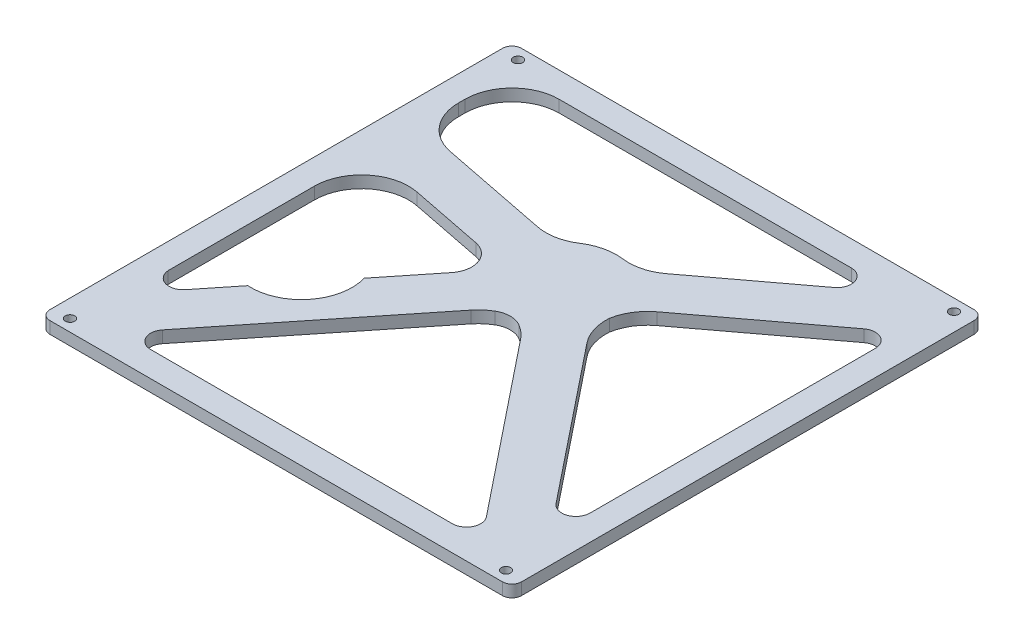
from build123d import *

# Parameters (mm, degrees)
SKETCH1_W           = 100
SKETCH1_H           = 100
BOSS_EXTRUDE1_DEPTH = 2.54
FILLET1_R           = 2
CUT_EXTRUDE1_DEPTH  = 10
SKETCH2_R           = 1
CUT_EXTRUDE2_DEPTH  = 10
FILLET2_R           = 10
FILLET3_R           = 5


with BuildPart() as part:
    # Sketch1 → Boss-Extrude1 (new body)
    with BuildSketch(Plane.XZ):
        Rectangle(SKETCH1_W, SKETCH1_H)
    extrude(amount=-BOSS_EXTRUDE1_DEPTH)

    # Fillet1
    fillet1_edges = [part.edges().sort_by_distance(p)[0] for p in [
        (-50, 1.27, 50),
        (50, 1.27, 50),
        (50, 1.27, -50),
        (-50, 1.27, -50),
    ]]
    fillet(fillet1_edges, radius=FILLET1_R)

    # Sketch5 → Cut-Extrude1 (cut)
    with BuildSketch(Plane(origin=(0, 2.54, 0), x_dir=(1, 0, 0), z_dir=(0, 1, 0))):
        with BuildLine():
            Line((-10.582420377, 8.15726173), (-44.633181304, 14.898200311))
            Line((-44.633181304, 14.898200311), (-44.633181304, -28.266598236))
            ThreePointArc((-44.633181304, -28.266598236), (-42.544556917, -30.942665333), (-39.296225546, -29.95674939))
            Line((-39.296225546, -29.95674939), (-33.420366711, -22.611976162))
            ThreePointArc((-33.420366711, -22.611976162), (-41.143464147, -5.184990934), (-22.44623806, -8.89440932))
            Line((-22.44623806, -8.89440932), (-10.025095622, 6.631912364))
            ThreePointArc((-10.025095622, 6.631912364), (-10.331945682, 7.384287968), (-10.582420377, 8.15726173))
        make_face()
        with BuildLine():
            Line((34.336383268, -39.764732741), (2.216428403, 0.384935794))
            ThreePointArc((2.216428403, 0.384935794), (0, 0.159324182), (-2.216428403, 0.384935794))
            Line((-2.216428403, 0.384935794), (-34.336383268, -39.764732741))
            ThreePointArc((-34.336383268, -39.764732741), (-34.697694983, -42.938387386), (-31.993783102, -44.638825712))
            Line((-31.993783102, -44.638825712), (31.993783102, -44.638825712))
            ThreePointArc((31.993783102, -44.638825712), (34.697694983, -42.938387386), (34.336383268, -39.764732741))
        make_face()
        with BuildLine():
            Line((39.838812559, 34.788749055), (10.83835688, 13.038158963))
            ThreePointArc((10.83835688, 13.038158963), (10.959514717, 12.102211852), (11, 11.159324182))
            ThreePointArc((11, 11.159324182), (10.75351226, 8.843730505), (10.025095622, 6.631912364))
            Line((10.025095622, 6.631912364), (39.296225546, -29.95674939))
            ThreePointArc((39.296225546, -29.95674939), (42.631851266, -30.913539718), (44.638825712, -28.08265642))
            Line((44.638825712, -28.08265642), (44.638825712, 32.38875892))
            ThreePointArc((44.638825712, 32.38875892), (42.980459146, 35.072044169), (39.838812559, 34.788749055))
        make_face()
        with BuildLine():
            Line((27.305635475, 44.638825712), (-34.363291806, 44.638825712))
            Line((-34.363291806, 44.638825712), (-44.633181304, 44.638825712))
            Line((-44.633181304, 44.638825712), (-44.633181304, 34.358849433))
            Line((-44.633181304, 34.358849433), (-44.633181304, 25.087137554))
            Line((-44.633181304, 25.087137554), (-8.643933661, 17.962441914))
            ThreePointArc((-8.643933661, 17.962441914), (-2.446557859, 21.883798745), (4.838313038, 21.038126081))
            Line((4.838313038, 21.038126081), (29.105648628, 39.238835577))
            ThreePointArc((29.105648628, 39.238835577), (30.15168277, 42.587516809), (27.305635475, 44.638825712))
        make_face()
        with BuildLine():
            Line((-33.420366711, -22.611976162), (-22.44623806, -8.89440932))
            ThreePointArc((-22.44623806, -8.89440932), (-41.143464147, -5.184990934), (-33.420366711, -22.611976162))
        make_face()
        with BuildLine():
            ThreePointArc((-22.01893977, -11.893547741), (-22.12630101, -10.378835302), (-22.44623806, -8.89440932))
            Line((-22.44623806, -8.89440932), (-33.420366711, -22.611976162))
            ThreePointArc((-33.420366711, -22.611976162), (-25.402259154, -19.71782477), (-22.01893977, -11.893547741))
        make_face()
    extrude(amount=-CUT_EXTRUDE1_DEPTH, mode=Mode.SUBTRACT)

    # Sketch2 → Cut-Extrude2 (cut)
    with BuildSketch(Plane(origin=(0, 2.54, 0), x_dir=(1, 0, 0), z_dir=(0, 1, 0))):
        with Locations(Location((-46.23, -47.5, 0), (0, 0, 90))):
            Circle(SKETCH2_R)
        with Locations(Location((-46.23, 47.5, 0), (0, 0, 90))):
            Circle(SKETCH2_R)
        with Locations(Location((46.23, 47.5, 0), (0, 0, 270))):
            Circle(SKETCH2_R)
        with Locations(Location((46.23, -47.5, 0), (0, 0, 270))):
            Circle(SKETCH2_R)
    extrude(amount=-CUT_EXTRUDE2_DEPTH, mode=Mode.SUBTRACT)

    # Fillet2
    # the kernel refuses this fillet: 10 mm, written as the material it adds along each edge
    with BuildSketch(Plane(origin=(-2.216428403, 2.54, -0.384935794), x_dir=(0.9991591303691161, 0, 0.04100039268143086), z_dir=(0, -1, 0)), Plane(origin=(-10.582420377, 2.54, -8.15726173), x_dir=(0.42439359901934914, 0, 0.9054778148090675), z_dir=(0, -1, 0))) as fillet2_piece_1:
        with BuildLine():
            CenterArc((5.15726697, 9.869275424), FILLET2_R, 216.310191596, 44.415308597)
            Line((-2.90096267, 3.94771017), (0, 0))
            ThreePointArc((0, 0), (1.772810521, 0.143797033), (3.545621042, 0))
        make_face()
    extrude(amount=2.54)
    with BuildSketch(Plane(origin=(2.216428403, 2.54, -0.384935794), x_dir=(0.6246976569815567, 0, 0.780866721894174), z_dir=(0, -1, 0)), Plane(origin=(10.83835688, 2.54, -13.038158963), x_dir=(0.7999967117807752, 0, -0.6000043842672711), z_dir=(0, -1, 0)), Plane(origin=(-10.025095622, 2.54, -6.631912364), x_dir=(-0.624697656981556, 0, 0.7808667218941745), z_dir=(0, -1, 0))) as fillet2_piece_2:
        with BuildLine():
            CenterArc((4.898979486, 10), FILLET2_R, 225.584691403, 44.415308597)
            ThreePointArc((-2.099562637, 2.857142857), (-0.933906367, 1.51372178), (0, 0))
            Line((0, 0), (4.898979486, 0))
        make_face()
    extrude(amount=2.54)
    with BuildSketch(Plane(origin=(4.838313038, 2.54, -21.038126081), x_dir=(0.7999967117807896, 0, -0.600004384267252), z_dir=(0, -1, 0)), Plane(origin=(10.025095622, 2.54, -6.631912364), x_dir=(0.6246976569815559, 0, 0.7808667218941746), z_dir=(0, -1, 0))) as fillet2_piece_3:
        with BuildLine():
            CenterArc((4.898979486, -10), FILLET2_R, 90, 44.415308597)
            ThreePointArc((-2.099562637, -2.857142857), (-0.933906367, -1.51372178), (0, 0))
            Line((0, 0), (4.898979486, 0))
        make_face()
    extrude(amount=2.54)
    with BuildSketch(Plane(origin=(-8.643933661, 2.54, -17.962441914), x_dir=(0.7370833881406508, 0, -0.6758018044716206), z_dir=(0, -1, 0))) as fillet2_piece_4:
        with BuildLine():
            CenterArc((5.159972861, -9.869137303), FILLET2_R, 99.279408895, 44.434942373)
            Line((-2.900792564, -3.951024364), (0, 0))
            ThreePointArc((0, 0), (1.773740671, -0.143948967), (3.547481342, 0))
        make_face()
    extrude(amount=2.54)
    with BuildSketch(Plane(origin=(-44.633181304, 2.54, -25.087137554), x_dir=(0.9809622556130392, 0, 0.19419848882671173), z_dir=(0, -1, 0))) as fillet2_piece_5:
        with BuildLine():
            CenterArc((FILLET2_R * 0.821439873515, -FILLET2_R), FILLET2_R, 90, 78.802094649)
            Line((-FILLET2_R * 0.159522382099, -FILLET2_R * 0.805801511173), (0, 0))
            Line((0, 0), (FILLET2_R * 0.821439873515, 0))
        make_face()
    extrude(amount=2.54)
    with BuildSketch(Plane(origin=(-44.633181304, 2.54, -44.638825712), x_dir=(1, 0, 0), z_dir=(0, -1, 0))) as fillet2_piece_6:
        with BuildLine():
            CenterArc((FILLET2_R, FILLET2_R), FILLET2_R, 180, 90)
            Line((0, FILLET2_R), (0, 0))
            Line((0, 0), (FILLET2_R, 0))
        make_face()
    extrude(amount=2.54)
    with BuildSketch(Plane(origin=(-44.633181304, 2.54, -14.898200311), x_dir=(0.9809622556130391, 0, 0.19419848882671228), z_dir=(0, -1, 0))) as fillet2_piece_7:
        with BuildLine():
            CenterArc((FILLET2_R * 1.21737455442, FILLET2_R), FILLET2_R, 168.802094649, 101.197905351)
            Line((FILLET2_R * 0.236412298804, FILLET2_R * 1.19419848883), (0, 0))
            Line((0, 0), (FILLET2_R * 1.21737455442, 0))
        make_face()
    extrude(amount=2.54)

    # Fillet3
    fillet3_edges = [part.edges().sort_by_distance(p)[0] for p in [
        (0, 1.27, 0.013314064),
        (-11.084977947, 1.27, -7.109148691),
    ]]
    fillet(fillet3_edges, radius=FILLET3_R)


solid = part.part
